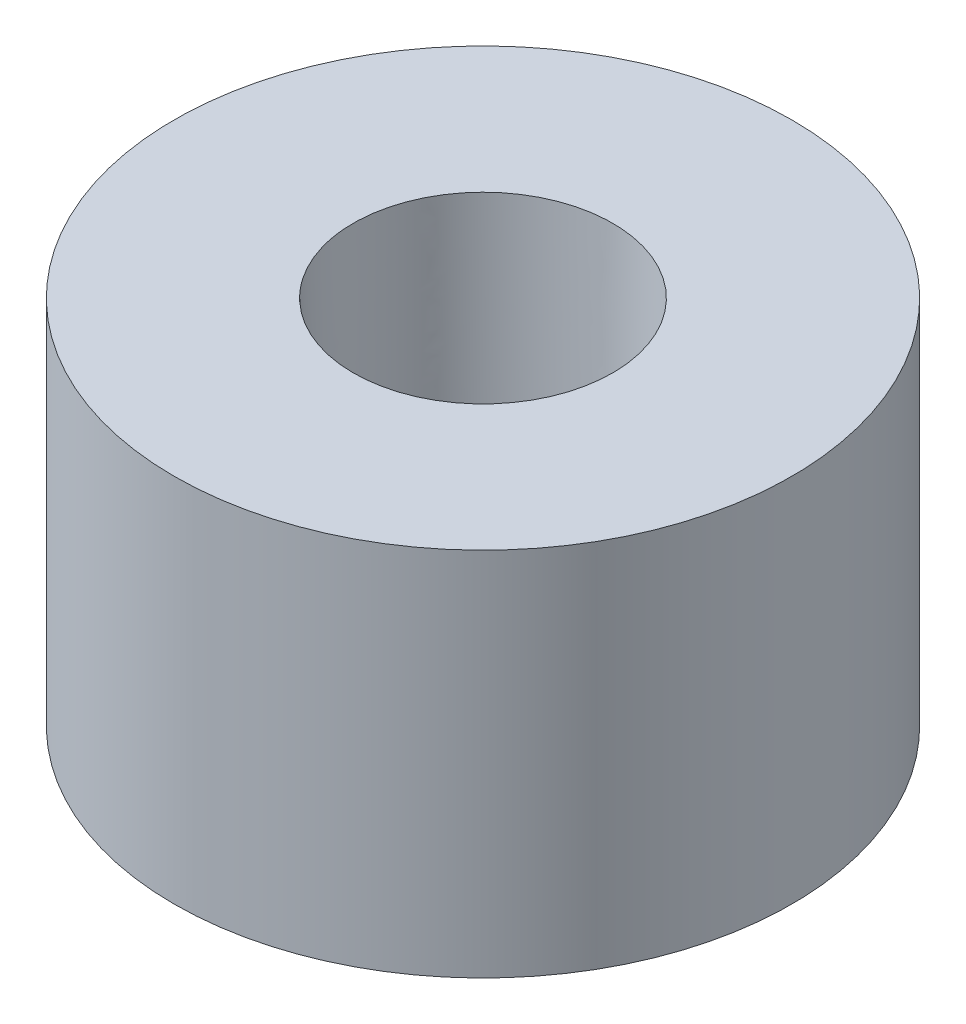
from build123d import *

# Parameters (mm, degrees)
SKETCH1_R           = 12.5
SKETCH1_R_2         = 5
BOSS_EXTRUDE1_DEPTH = 15


with BuildPart() as part:
    # Sketch1 → Boss-Extrude1 (new body)
    with BuildSketch(Plane(origin=(0, 0, 0), x_dir=(1, 0, 0), z_dir=(0, 1, 0))):
        with Locations(Location((0, 0, 0), (0, 0, 270))):
            Circle(SKETCH1_R)
        with Locations(Location((0, 0, 0), (0, 0, 270))):
            Circle(SKETCH1_R_2, mode=Mode.SUBTRACT)
    extrude(amount=BOSS_EXTRUDE1_DEPTH)

    # Cut-Loft1: read off the stored shape, not the designer's step
    # Cut-Loft1: loft between two sections, ruled curve by curve
    cut_loft1_from = [
        Edge.make_bspline([(4.028401148, 0, -2.961753567), (-1.895105985, 0, -11.018555863), (-9.951908281, 0, -5.09504873), (-4.028401148, 0, 2.961753567), (1.895105985, 0, 11.018555863), (9.951908281, 0, 5.09504873), (4.028401148, 0, -2.961753567)], [0, 0, 0, 0, 0.5, 0.5, 0.5, 1, 1, 1, 1], 3, [1, 0.333333333, 0.333333333, 1, 0.333333333, 0.333333333, 1]),
    ]
    cut_loft1_to = [
        Edge.make_bspline([(4.743296063, 15, -2.250253865), (0.242788334, 15, -11.736845991), (-9.243803793, 15, -7.236338262), (-4.743296063, 15, 2.250253865), (-0.242788334, 15, 11.736845991), (9.243803793, 15, 7.236338262), (4.743296063, 15, -2.250253865)], [0, 0, 0, 0, 0.5, 0.5, 0.5, 1, 1, 1, 1], 3, [1, 0.333333333, 0.333333333, 1, 0.333333333, 0.333333333, 1]),
    ]
    cut_loft1 = Solid(Shell([*[Face.make_surface_from_curves(cut_loft1_from[k], cut_loft1_to[k]) for k in range(1)], Face(Wire(cut_loft1_from)), Face(Wire(cut_loft1_to))]))
    add(cut_loft1, mode=Mode.SUBTRACT)


solid = part.part
